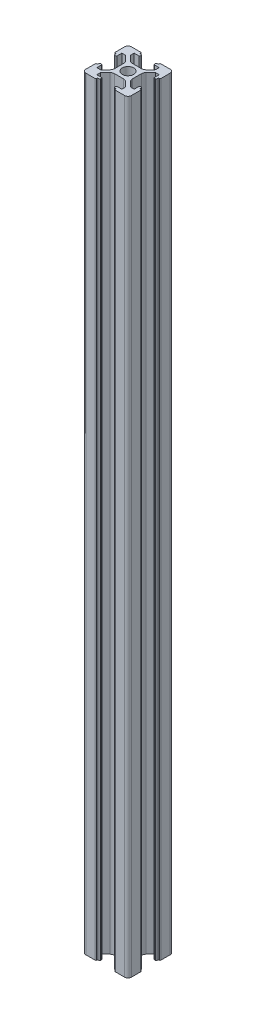
from build123d import *

# Parameters (mm, degrees)
BOSS_EXTRUDE1_DEPTH = 335
FILLET1_R           = 0.35


with BuildPart() as part:
    # Sketch1 → Boss-Extrude1 (new body)
    with BuildSketch(Plane(origin=(0, 0, 0), x_dir=(1, 0, 0), z_dir=(0, 1, 0))):
        with BuildLine():
            Line((5.5, 6.560660172), (3.425126266, 4.485786438))
            ThreePointArc((3.425126266, 4.485786438), (2.776279568, 4.052240935), (2.010912703, 3.9))
            Line((2.010912703, 3.9), (0, 3.9))
            Line((0, 3.899999921), (-2.010912625, 3.899999921))
            ThreePointArc((-2.010912625, 3.899999921), (-2.77627949, 4.052240856), (-3.425126187, 4.485786359))
            Line((-3.425126187, 4.485786359), (-5.5, 6.560660172))
            Line((-5.5, 6.560660172), (-5.5, 8.2))
            Line((-5.5, 8.2), (-3.1, 8.2))
            Line((-3.1, 8.2), (-3.1, 9.24))
            Line((-3.1, 9.24), (-4.1, 9.24))
            Line((-4.1, 9.24), (-4.1, 10))
            Line((-4.1, 10), (-8.5, 10))
            ThreePointArc((-8.5, 10), (-9.560660172, 9.560660172), (-10, 8.5))
            Line((-10, 8.5), (-10, 4.1))
            Line((-10, 4.1), (-9.24, 4.1))
            Line((-9.24, 4.1), (-9.24, 3.1))
            Line((-9.24, 3.1), (-8.2, 3.1))
            Line((-8.2, 3.1), (-8.2, 5.5))
            Line((-8.2, 5.5), (-6.560660172, 5.5))
            Line((-6.560660172, 5.5), (-4.485786438, 3.425126266))
            ThreePointArc((-4.485786438, 3.425126266), (-4.052240935, 2.776279568), (-3.9, 2.010912703))
            Line((-3.9, 2.010912703), (-3.9, 0))
            Line((-3.899999921, 0), (-3.899999921, -2.010912625))
            ThreePointArc((-3.899999921, -2.010912625), (-4.052240856, -2.77627949), (-4.485786359, -3.425126187))
            Line((-4.485786359, -3.425126187), (-6.560660172, -5.5))
            Line((-6.560660172, -5.5), (-8.2, -5.5))
            Line((-8.2, -5.5), (-8.2, -3.1))
            Line((-8.2, -3.1), (-9.24, -3.1))
            Line((-9.24, -3.1), (-9.24, -4.1))
            Line((-9.24, -4.1), (-10, -4.1))
            Line((-10, -4.1), (-10, -8.5))
            ThreePointArc((-10, -8.5), (-9.560660172, -9.560660172), (-8.5, -10))
            Line((-8.5, -10), (-4.1, -10))
            Line((-4.1, -10), (-4.1, -9.24))
            Line((-4.1, -9.24), (-3.1, -9.24))
            Line((-3.1, -9.24), (-3.1, -8.2))
            Line((-3.1, -8.2), (-5.5, -8.2))
            Line((-5.5, -8.2), (-5.5, -6.560660172))
            Line((-5.5, -6.560660172), (-3.425126266, -4.485786438))
            ThreePointArc((-3.425126266, -4.485786438), (-2.776279568, -4.052240935), (-2.010912703, -3.9))
            Line((-2.010912703, -3.9), (0, -3.9))
            Line((0, -3.899999921), (2.010912625, -3.899999921))
            ThreePointArc((2.010912625, -3.899999921), (2.77627949, -4.052240856), (3.425126187, -4.485786359))
            Line((3.425126187, -4.485786359), (5.5, -6.560660172))
            Line((5.5, -6.560660172), (5.5, -8.2))
            Line((5.5, -8.2), (3.1, -8.2))
            Line((3.1, -8.2), (3.1, -9.24))
            Line((3.1, -9.24), (4.1, -9.24))
            Line((4.1, -9.24), (4.1, -10))
            Line((4.1, -10), (8.5, -10))
            ThreePointArc((8.5, -10), (9.560660172, -9.560660172), (10, -8.5))
            Line((10, -8.5), (10, -4.1))
            Line((10, -4.1), (9.24, -4.1))
            Line((9.24, -4.1), (9.24, -3.1))
            Line((9.24, -3.1), (8.2, -3.1))
            Line((8.2, -3.1), (8.2, -5.5))
            Line((8.2, -5.5), (6.560660172, -5.5))
            Line((6.560660172, -5.5), (4.485786438, -3.425126266))
            ThreePointArc((4.485786438, -3.425126266), (4.052240935, -2.776279568), (3.9, -2.010912703))
            Line((3.9, -2.010912703), (3.9, 0))
            Line((3.899999921, 0), (3.899999921, 2.010912625))
            ThreePointArc((3.899999921, 2.010912625), (4.052240856, 2.77627949), (4.485786359, 3.425126187))
            Line((4.485786359, 3.425126187), (6.560660172, 5.5))
            Line((6.560660172, 5.5), (8.2, 5.5))
            Line((8.2, 5.5), (8.2, 3.1))
            Line((8.2, 3.1), (9.24, 3.1))
            Line((9.24, 3.1), (9.24, 4.1))
            Line((9.24, 4.1), (10, 4.1))
            Line((10, 4.1), (10, 8.5))
            ThreePointArc((10, 8.5), (9.560660172, 9.560660172), (8.5, 10))
            Line((8.5, 10), (4.1, 10))
            Line((4.1, 10), (4.1, 9.24))
            Line((4.1, 9.24), (3.1, 9.24))
            Line((3.1, 9.24), (3.1, 8.2))
            Line((3.1, 8.2), (5.5, 8.2))
            Line((5.5, 8.2), (5.5, 6.560660172))
        make_face()
        with BuildLine():
            ThreePointArc((0, 2.5), (1.767766953, 1.767766953), (2.5, 0))
            ThreePointArc((2.5, 0), (1.767766953, -1.767766953), (0, -2.5))
            ThreePointArc((0, -2.5), (-1.767766953, -1.767766953), (-2.5, 0))
            ThreePointArc((-2.5, 0), (-1.767766953, 1.767766953), (0, 2.5))
        make_face(mode=Mode.SUBTRACT)
    extrude(amount=BOSS_EXTRUDE1_DEPTH)

    # Fillet1
    fillet1_edges = [part.edges().sort_by_distance(p)[0] for p in [
        (-4.1, 167.5, -10),
        (-4.1, 167.5, -9.24),
        (-3.1, 167.5, -9.24),
        (-3.1, 167.5, -8.2),
        (-9.24, 167.5, -4.1),
        (-10, 167.5, -4.1),
        (-9.24, 167.5, -3.1),
        (-8.2, 167.5, -3.1),
        (-10, 167.5, 4.1),
        (-9.24, 167.5, 4.1),
        (-9.24, 167.5, 3.1),
        (-8.2, 167.5, 3.1),
        (-4.1, 167.5, 10),
        (-4.1, 167.5, 9.24),
        (-3.1, 167.5, 9.24),
        (-3.1, 167.5, 8.2),
        (4.1, 167.5, 10),
        (4.1, 167.5, 9.24),
        (3.1, 167.5, 9.24),
        (3.1, 167.5, 8.2),
        (10, 167.5, 4.1),
        (9.24, 167.5, 4.1),
        (9.24, 167.5, 3.1),
        (8.2, 167.5, 3.1),
        (10, 167.5, -4.1),
        (9.24, 167.5, -4.1),
        (9.24, 167.5, -3.1),
        (8.2, 167.5, -3.1),
        (3.1, 167.5, -8.2),
        (4.1, 167.5, -10),
        (5.5, 167.5, -6.560660172),
        (3.1, 167.5, -9.24),
        (4.1, 167.5, -9.24),
    ]]
    fillet(fillet1_edges, radius=FILLET1_R)


solid = part.part
